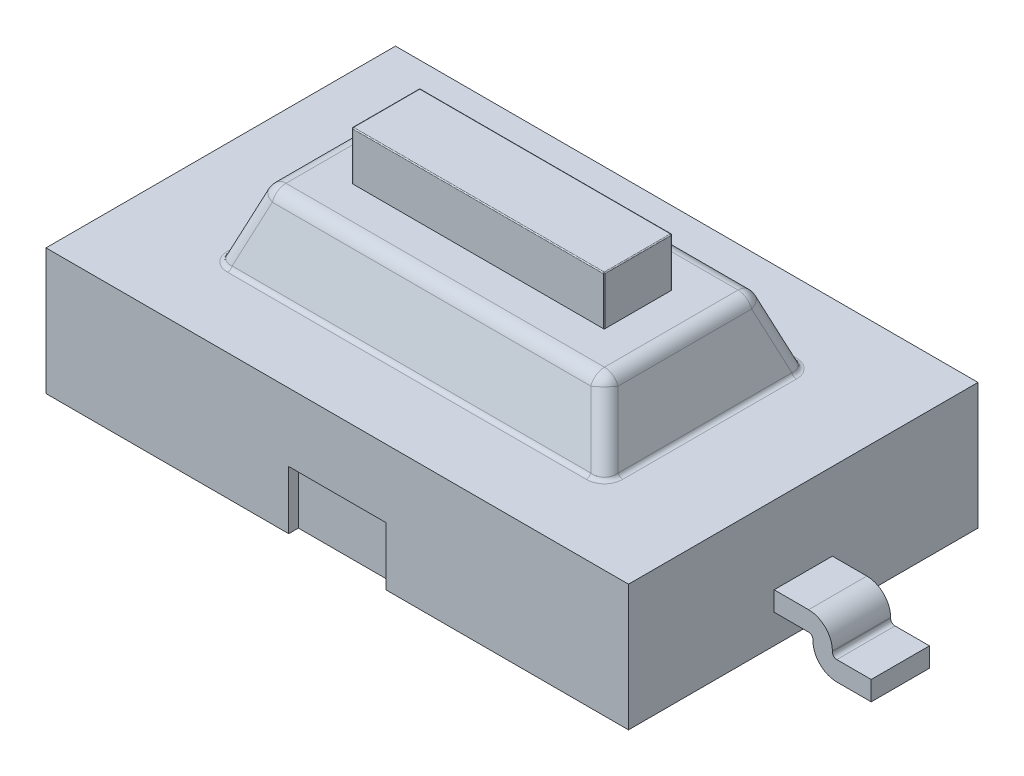
from build123d import *

# Parameters (mm, degrees)
EXTRUDE_1_DEPTH      = 1.2
EXTRUDE_1_DEPTH_BACK = 0.1
SKETCH_1_W           = 6
SKETCH_1_H           = 3.6
SKETCH_2_W           = 3.99994682
SKETCH_2_H           = 2.095094112
EXTRUDE_2_DEPTH      = 0.7
EXTRUDE_2_TAPER      = 20
FILLET_1_R           = 0.15
FILLET_2_R           = 0.15
FILLET_3_R           = 0.05
SKETCH_3_W           = 2.6
SKETCH_3_H           = 0.7
EXTRUDE_3_DEPTH      = 0.5
FILLET_4_R           = 0.01
SKETCH_4_W           = 1
SKETCH_4_H           = 0.6
CUT_EXTRUDE_6_DEPTH  = 0.1
SKETCH_12_W          = 1
SKETCH_12_H          = 0.6
CUT_EXTRUDE_7_DEPTH  = 0.1
SKETCH_16_W          = 0.6
SKETCH_16_H          = 0.2
SKETCH_13_W          = 0.6
SKETCH_13_H          = 0.2


with BuildPart() as part:
    # Эскиз1 → Бобышка-Вытянуть1 (new, two sides: drawn at the far end of the back side and taken through both)
    with BuildSketch(Plane(origin=(0, 0, 0), x_dir=(1, 0, 0), z_dir=(0, 1, 0)).offset(-EXTRUDE_1_DEPTH_BACK)):
        Rectangle(SKETCH_1_W, SKETCH_1_H)
    extrude(amount=EXTRUDE_1_DEPTH + EXTRUDE_1_DEPTH_BACK)

    # Эскиз2 → Бобышка-Вытянуть2 (add)
    with BuildSketch(Plane(origin=(0, 1.2, 0), x_dir=(1, 0, 0), z_dir=(0, 1, 0))):
        Rectangle(SKETCH_2_W, SKETCH_2_H)
    extrude(amount=EXTRUDE_2_DEPTH, taper=EXTRUDE_2_TAPER)

    # Скругление1
    fillet_1_edges = [part.edges().sort_by_distance(p)[0] for p in [
        (1.872583828, 1.55, 0.920157474),
        (1.872583828, 1.55, -0.920157474),
        (-1.872583828, 1.55, -0.920157474),
        (-1.872583828, 1.55, 0.920157474),
    ]]
    fillet(fillet_1_edges, radius=FILLET_1_R)

    # Скругление2
    fillet_2_edges = [part.edges().sort_by_distance(p)[0] for p in [
        (1.745194246, 1.9, 0),
        (1.704859962, 1.9, 0.752433608),
        (1.704859962, 1.9, -0.752433608),
        (0, 1.9, 0.792767892),
        (0, 1.9, -0.792767892),
        (-1.704859962, 1.9, 0.752433608),
        (-1.704859962, 1.9, -0.752433608),
        (-1.745194246, 1.9, 0),
    ]]
    fillet(fillet_2_edges, radius=FILLET_2_R)

    # Скругление3
    fillet_3_edges = [part.edges().sort_by_distance(p)[0] for p in [
        (-1.959639126, 1.2, 1.007212772),
        (-1.959639126, 1.2, -1.007212772),
        (1.959639126, 1.2, -1.007212772),
        (1.959639126, 1.2, 1.007212772),
        (1.99997341, 1.2, 0),
        (0, 1.2, -1.047547056),
        (-1.99997341, 1.2, 0),
        (0, 1.2, 1.047547056),
    ]]
    fillet(fillet_3_edges, radius=FILLET_3_R)

    # Эскиз3 → Бобышка-Вытянуть3 (add)
    with BuildSketch(Plane(origin=(0, 1.9, 0), x_dir=(1, 0, 0), z_dir=(0, 1, 0))):
        Rectangle(SKETCH_3_W, SKETCH_3_H)
    extrude(amount=EXTRUDE_3_DEPTH)

    # Скругление4
    fillet_4_edges = [part.edges().sort_by_distance(p)[0] for p in [
        (0, 2.4, 0.35),
        (-1.3, 2.4, 0),
        (0, 2.4, -0.35),
        (1.3, 2.4, 0),
        (-1.3, 2.15, -0.35),
        (-1.3, 2.15, 0.35),
        (1.3, 2.15, -0.35),
        (1.3, 2.15, 0.35),
    ]]
    fillet(fillet_4_edges, radius=FILLET_4_R)

    # Эскиз4 → Вырез-Вытянуть6 (cut)
    with BuildSketch(Plane.XY.offset(1.8)):
        with Locations((0, 0.2)):
            Rectangle(SKETCH_4_W, SKETCH_4_H)
    extrude(amount=-CUT_EXTRUDE_6_DEPTH, mode=Mode.SUBTRACT)

    # Эскиз12 → Вырез-Вытянуть7 (cut)
    with BuildSketch(Plane(origin=(0, 0, -1.8), x_dir=(-1, 0, 0), z_dir=(0, 0, -1))):
        with Locations((0, 0.2)):
            Rectangle(SKETCH_12_W, SKETCH_12_H)
    extrude(amount=-CUT_EXTRUDE_7_DEPTH, mode=Mode.SUBTRACT)

    # По траектории2: sweep along a path in Эскиз14
    with BuildLine(Plane.XY) as sweep_2_path:
        Line((-3, 0.3), (-3.355, 0.3))
        ThreePointArc((-3.355, 0.3), (-3.457530483, 0.257530483), (-3.5, 0.155))
        Line((-3.5, 0.155), (-3.5, 0.145))
        ThreePointArc((-3.5, 0.145), (-3.542469517, 0.042469517), (-3.645, 0))
        Line((-3.645, 0), (-4, 0))
    # Эскиз16 → По траектории2 (sweep)
    with BuildSketch(Plane.ZY.offset(3)):
        with Locations((0, 0.3)):
            Rectangle(SKETCH_16_W, SKETCH_16_H)
    sweep(path=sweep_2_path.line)

    # По траектории3: sweep along a path in Эскиз17
    with BuildLine(Plane.XY) as sweep_3_path:
        Line((3, 0.3), (3.355, 0.3))
        ThreePointArc((3.355, 0.3), (3.457530483, 0.257530483), (3.5, 0.155))
        Line((3.5, 0.155), (3.5, 0.145))
        ThreePointArc((3.5, 0.145), (3.542469517, 0.042469517), (3.645, 0))
        Line((3.645, 0), (4, 0))
    # Эскиз13 → По траектории3 (sweep)
    with BuildSketch(Plane(origin=(3, 0, 0), x_dir=(0, 0, -1), z_dir=(1, 0, 0))):
        with Locations((0, 0.3)):
            Rectangle(SKETCH_13_W, SKETCH_13_H)
    sweep(path=sweep_3_path.line)


solid = part.part
